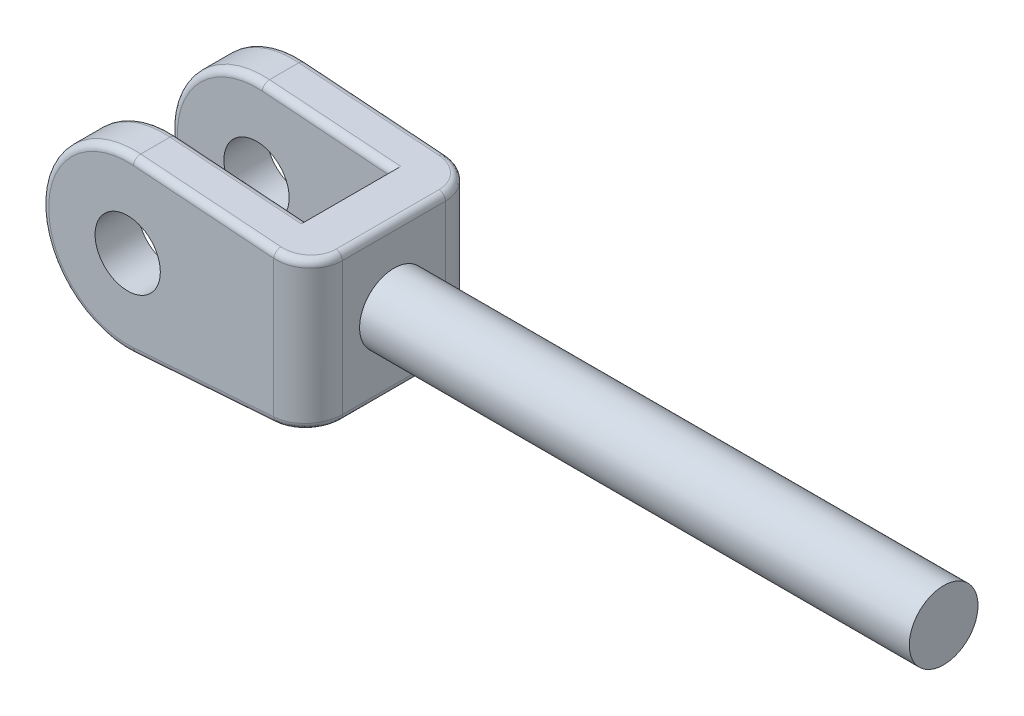
from build123d import *

# Parameters (mm, degrees)
SKETCH2_R               = 1
BOSS_EXTRUDE1_DEPTH     = 16
SKETCH3_R               = 0.95
BOSS_EXTRUDE2_DEPTH     = 2.5
CUT_EXTRUDE1_DEPTH      = 17.385969608
CUT_EXTRUDE1_DEPTH_BACK = 17.385969608
SKETCH4_W               = 6.5
SKETCH4_H               = 2.5
FILLET1_R               = 1
FILLET2_R               = 0.2
FILLET3_R               = 0.2
FILLET4_R               = 0.2


with BuildPart() as part:
    # Sketch2 → Boss-Extrude1 (new body)
    with BuildSketch(Plane(origin=(0, 0, 0), x_dir=(0, 0, -1), z_dir=(1, 0, 0))):
        Circle(SKETCH2_R)
    extrude(amount=BOSS_EXTRUDE1_DEPTH)

    # Sketch3 → Boss-Extrude2 (add, symmetric)
    with BuildSketch(Plane.XY):
        with BuildLine():
            Line((0, -2.125), (0, 2.125))
            Line((0, 2.125), (-5.06876613, 2.493422203))
            ThreePointArc((-5.06876613, 2.493422203), (-7.75, 0), (-5.06876613, -2.493422203))
            Line((-5.06876613, -2.493422203), (0, -2.125))
        make_face()
        with Locations((-5.25, 0)):
            Circle(SKETCH3_R, mode=Mode.SUBTRACT)
    extrude(amount=BOSS_EXTRUDE2_DEPTH, both=True)

    # Sketch4 → Cut-Extrude1 (cut, two sides: drawn at the far end of the back side and taken through both)
    with BuildSketch(Plane(origin=(0, 0, 0), x_dir=(1, 0, 0), z_dir=(0, 1, 0)).offset(-CUT_EXTRUDE1_DEPTH_BACK)):
        with Locations((-4.5, 0)):
            Rectangle(SKETCH4_W, SKETCH4_H)
    extrude(amount=CUT_EXTRUDE1_DEPTH + CUT_EXTRUDE1_DEPTH_BACK, mode=Mode.SUBTRACT)

    # Fillet1
    fillet1_edges = [part.edges().sort_by_distance(p)[0] for p in [
        (0, 0, -2.5),
        (0, 0, 2.5),
    ]]
    fillet(fillet1_edges, radius=FILLET1_R)

    # Fillet2
    fillet2_edges = [part.edges().sort_by_distance(p)[0] for p in [
        (-0.293359104, 2.146322745, 2.20757236),
        (0, 2.125, 0),
        (-0.293359104, 2.146322745, -2.20757236),
        (-3.034383065, 2.345553497, -2.5),
        (-7.75, 0, -2.5),
        (-3.034383065, -2.345553497, -2.5),
        (-0.293359104, -2.146322745, -2.20757236),
        (0, -2.125, 0),
        (-0.293359104, -2.146322745, 2.20757236),
        (-3.034383065, -2.345553497, 2.5),
        (-7.75, 0, 2.5),
        (-3.034383065, 2.345553497, 2.5),
    ]]
    fillet(fillet2_edges, radius=FILLET2_R)

    # Fillet3
    fillet3_edges = [part.edges().sort_by_distance(p)[0] for p in [
        (-3.159383065, -2.354639096, -1.25),
        (-7.75, 0, -1.25),
        (-3.159383065, 2.354639096, -1.25),
    ]]
    fillet(fillet3_edges, radius=FILLET3_R)

    # Fillet4
    fillet4_edges = [part.edges().sort_by_distance(p)[0] for p in [
        (-3.159383065, -2.354639096, 1.25),
        (-7.75, 0, 1.25),
        (-3.159383065, 2.354639096, 1.25),
    ]]
    fillet(fillet4_edges, radius=FILLET4_R)


solid = part.part
